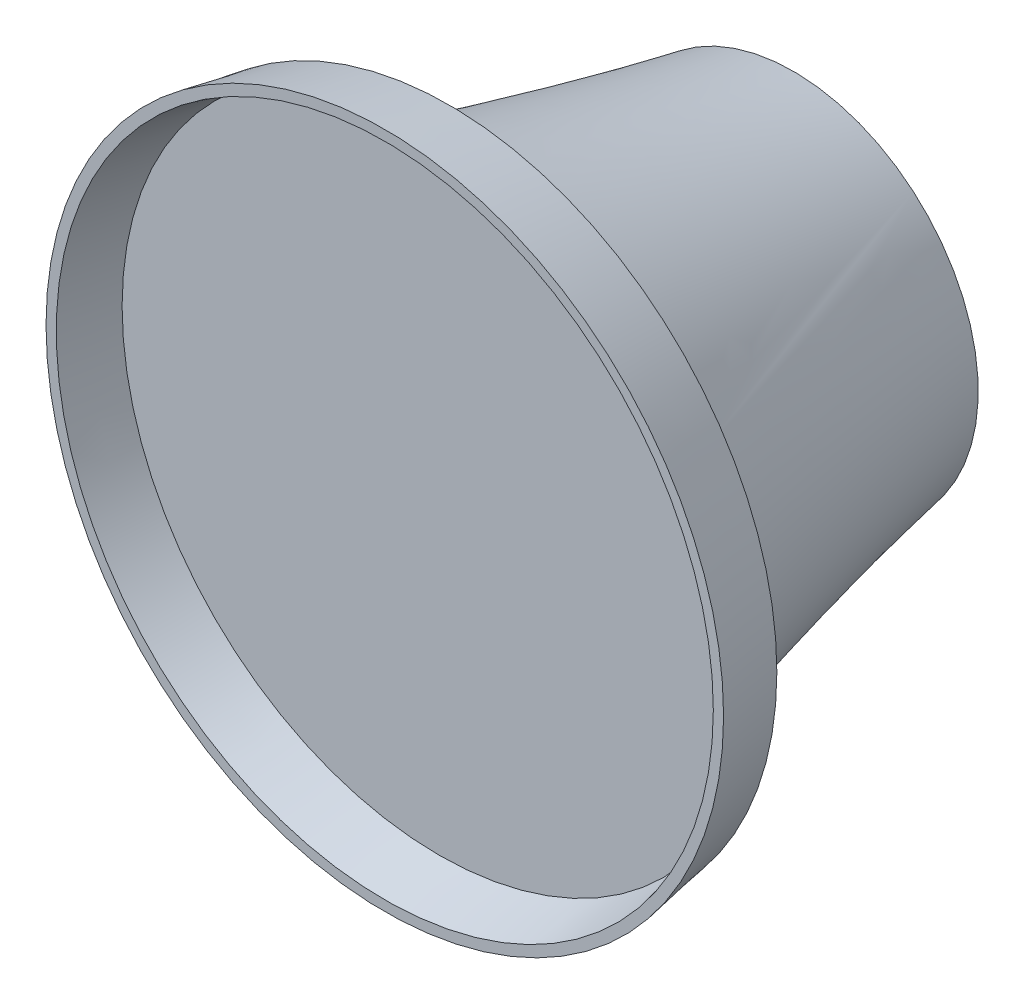
from build123d import *

# Parameters (mm, degrees)
IZIM3_R                     = 25.05
Y_KSEKLIK_EKSTR_ZYON1_DEPTH = 3.5


with BuildPart() as part:
    # Çizim2 → Döndür1 (revolve)
    with BuildSketch(Plane(origin=(0, 0, 0), x_dir=(1, 0, 0), z_dir=(0, 1, 0)), mode=Mode.PRIVATE) as d_nd_r1_sk:
        Polygon((-33, 0), (-31.889140022, 6.3), (-30.889140022, 6.3), (0, 6.3), (0, 5.3), (-30.889140022, 5.3), (-32, 0), align=None)
    revolve(d_nd_r1_sk.sketch.rotate(Axis((0, 0, 0), (0, 0, -1)), 180), axis=Axis((0, 0, 0), (0, 0, -1)))

    # Çizim3 → Yükseklik-Ekstrüzyon1 (add)
    with BuildSketch(Plane(origin=(0, 0, -6.3), x_dir=(-1, 0, 0), z_dir=(0, 0, -1))):
        Circle(IZIM3_R)
    extrude(amount=Y_KSEKLIK_EKSTR_ZYON1_DEPTH)

    # Loft1: read off the stored shape, not the designer's step
    # Loft1: loft between two sections, ruled curve by curve
    loft1_from = [
        Edge.make_bspline([(11.664244151, 13.709318305, -39.8), (-15.754392459, 37.037806607, -39.8), (-39.082880761, 9.619169997, -39.8), (-11.664244151, -13.709318305, -39.8), (15.754392459, -37.037806607, -39.8), (39.082880761, -9.619169997, -39.8), (11.664244151, 13.709318305, -39.8)], [0, 0, 0, 0, 0.5, 0.5, 0.5, 1, 1, 1, 1], 3, [1, 0.333333333, 0.333333333, 1, 0.333333333, 0.333333333, 1]),
    ]
    loft1_to = [
        Edge.make_bspline([(21.774798676, 12.38388641, -9.8), (-2.992974145, 55.933483762, -9.8), (-46.542571497, 31.165710941, -9.8), (-21.774798676, -12.38388641, -9.8), (2.992974145, -55.933483762, -9.8), (46.542571497, -31.165710941, -9.8), (21.774798676, 12.38388641, -9.8)], [0, 0, 0, 0, 0.5, 0.5, 0.5, 1, 1, 1, 1], 3, [1, 0.333333333, 0.333333333, 1, 0.333333333, 0.333333333, 1]),
    ]
    loft1 = Solid(Shell([*[Face.make_surface_from_curves(loft1_from[k], loft1_to[k]) for k in range(1)], Face(Wire(loft1_from)), Face(Wire(loft1_to))]))
    add(loft1)


solid = part.part
